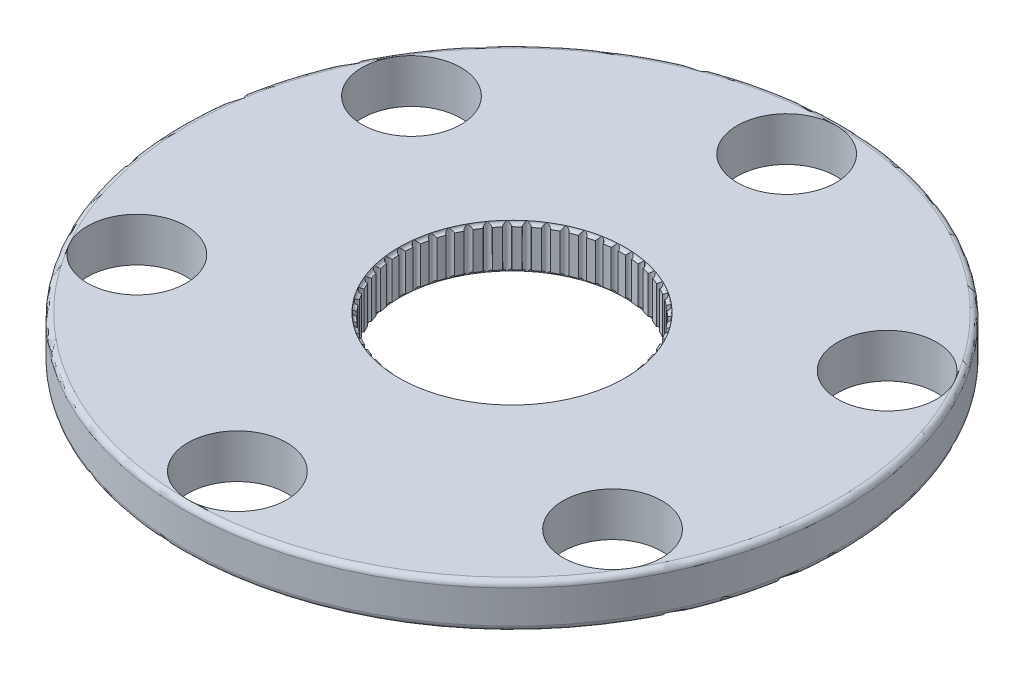
from build123d import *

# Parameters (mm, degrees)
SKETCH2_R           = 150
SKETCH2_R_2         = 50
SKETCH2_R_3         = 22.5
BOSS_EXTRUDE1_DEPTH = 10
SKETCH3_R           = 1.5
SKETCH4_R           = 1.5
CUT_EXTRUDE1_DEPTH  = 213.367605816
CIRPATTERN1_COUNT   = 50
FILLET1_R           = 2.5


with BuildPart() as part:
    # Sketch2 → Boss-Extrude1 (new, symmetric)
    with BuildSketch(Plane(origin=(0, 0, 0), x_dir=(1, 0, 0), z_dir=(0, 1, 0))):
        with Locations(Location((0, 0, 0), (0, 0, 270))):
            Circle(SKETCH2_R)
        with Locations(Location((0, 0, 0), (0, 0, 270))):
            Circle(SKETCH2_R_2, mode=Mode.SUBTRACT)
        with Locations(Location((0, 125, 0), (0, 0, 270))):
            Circle(SKETCH2_R_3, mode=Mode.SUBTRACT)
        with Locations(Location((108.253175473, 62.5, 0), (0, 0, 270))):
            Circle(SKETCH2_R_3, mode=Mode.SUBTRACT)
        with Locations(Location((108.253175473, -62.5, 0), (0, 0, 270))):
            Circle(SKETCH2_R_3, mode=Mode.SUBTRACT)
        with Locations(Location((0, -125, 0), (0, 0, 270))):
            Circle(SKETCH2_R_3, mode=Mode.SUBTRACT)
        with Locations(Location((-108.253175473, -62.5, 0), (0, 0, 270))):
            Circle(SKETCH2_R_3, mode=Mode.SUBTRACT)
        with Locations(Location((-108.253175473, 62.5, 0), (0, 0, 270))):
            Circle(SKETCH2_R_3, mode=Mode.SUBTRACT)
    extrude(amount=BOSS_EXTRUDE1_DEPTH, both=True)

    # Sketch3 → Cut-Revolve1 (revolve, cut)
    with BuildSketch(Plane(origin=(0, 0, 0), x_dir=(0, 0, -1), z_dir=(1, 0, 0)), mode=Mode.PRIVATE) as cut_revolve1_sk:
        with Locations((-50, 10)):
            Circle(SKETCH3_R)
        with Locations((-50, -10)):
            Circle(SKETCH3_R)
    revolve(cut_revolve1_sk.sketch.rotate(Axis((0, 0, 0), (0, 1, 0)), 180), axis=Axis((0, 0, 0), (0, 1, 0)), mode=Mode.SUBTRACT)

    # Sketch4 → Cut-Extrude1 (cut, symmetric)
    with BuildSketch(Plane(origin=(0, 0, 0), x_dir=(1, 0, 0), z_dir=(0, 1, 0))):
        with Locations((-50, 0)):
            Circle(SKETCH4_R)
    cut_extrude1 = extrude(amount=CUT_EXTRUDE1_DEPTH, both=True, mode=Mode.SUBTRACT)

    # CirPattern1: Cut-Extrude1 ×50 about axis
    cirpattern1_axis = Axis((0, 0, 0), (0, 1, 0))
    for i in range(1, CIRPATTERN1_COUNT):
        add(cut_extrude1.rotate(cirpattern1_axis, i * 360 / CIRPATTERN1_COUNT), mode=Mode.SUBTRACT)

    # Fillet1
    fillet1_edges = [part.edges().sort_by_distance(p)[0] for p in [
        (0, -10, -150),
        (0, 10, -150),
    ]]
    fillet(fillet1_edges, radius=FILLET1_R - 0.0001)  # a hair under: the kernel refuses the full size


solid = part.part
